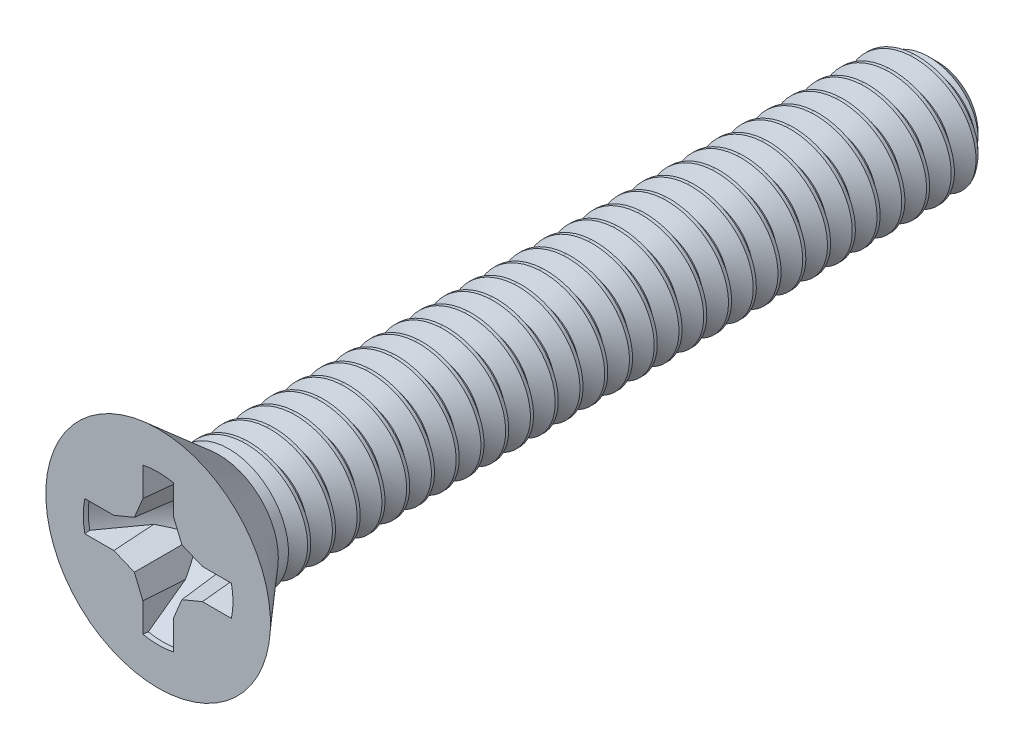
from build123d import *

# Parameters (mm, degrees)
CUT_EXTRUDE1_REACH = 16.581
CIRPATTERN1_COUNT  = 4
DRAFT2_ANGLE       = 5
CUT_SWEEP1_PITCH   = 0.453571429
CUT_SWEEP1_TO      = 12.9921


with BuildPart() as part:
    # Sketch3 → Revolve1 (revolve)
    with BuildSketch(Plane(origin=(0, 0, 0), x_dir=(0, 0, -1), z_dir=(1, 0, 0)), mode=Mode.PRIVATE) as revolve1_sk:
        Polygon((-1.2954, 0), (-1.2954, 2.0574), (-0.185064413, 1.0922), (-0.185064413, 0), align=None)
    revolve(revolve1_sk.sketch.rotate(Axis((0, 0, 1.2954), (0, 0, -1)), 180), axis=Axis((0, 0, 1.2954), (0, 0, -1)))

    # Sketch5 → Revolve2 (revolve)
    with BuildSketch(Plane(origin=(0, 0, 0), x_dir=(0, 0, -1), z_dir=(1, 0, 0))):
        Polygon((12.9921, 0), (-0.185064413, 0), (-0.185064413, 1.0922), (12.633778571, 1.0922), (12.9921, 0.733878571), align=None)
    revolve(axis=Axis((0, 0, -12.9921), (0, 0, 1)))

    # Cut-Extrude1: up to this cone (the profile starts inside it)
    cut_extrude1_end = Plane(origin=(0, 0, 1.2954), z_dir=(0, 0, 1)).offset(-1.66987845) * Cone(1e-06, 17.561750986, 20.202482509, align=(Align.CENTER, Align.CENTER, Align.MIN), mode=Mode.PRIVATE)
    # Sketch4 → Cut-Extrude1 (cut, up to the surface)
    with BuildSketch(Plane.XY.offset(1.2954), mode=Mode.PRIVATE) as cut_extrude1_sk1:
        with BuildLine():
            Line((0, 0), (1.3716, 0))
            ThreePointArc((1.3716, 0), (1.36439133, 0.140438096), (1.342841093, 0.2794))
            Line((1.342841093, 0.2794), (0.811120546, 0.2794))
            Line((0.811120546, 0.2794), (0.435137342, 0.435137342))
            Line((0.435137342, 0.435137342), (0.2794, 0.811120546))
            Line((0.2794, 0.811120546), (0.2794, 1.342841093))
            ThreePointArc((0.2794, 1.342841093), (0.140438096, 1.36439133), (0, 1.3716))
            Line((0, 1.3716), (0, 0))
        make_face()
    cut_extrude1_tool1 = extrude(cut_extrude1_sk1.sketch, amount=-CUT_EXTRUDE1_REACH, mode=Mode.PRIVATE) & cut_extrude1_end
    cut_extrude1 = cut_extrude1_tool1.solids().sort_by_distance((0.019397, 0.6858, 1.2954))[0]
    add(cut_extrude1, mode=Mode.SUBTRACT)

    # CirPattern1: Cut-Extrude1 ×4 about axis
    cirpattern1_axis = Axis((0, 0, 0), (0, 0, 1))
    for i in range(1, CIRPATTERN1_COUNT):
        add(cut_extrude1.rotate(cirpattern1_axis, i * 360 / CIRPATTERN1_COUNT), mode=Mode.SUBTRACT)

    # Draft2
    draft2_faces = [part.faces().sort_by_distance(p)[0] for p in [
        (-1.009640358, 0.2794, 1.06337498),
        (-0.612574228, 0.361640578, 0.873122436),
        (-0.361640578, 0.612574228, 0.873122436),
        (-0.2794, 1.009640358, 1.06337498),
        (0.2794, 1.009640358, 1.06337498),
        (0.361640578, 0.612574228, 0.873122436),
        (0.612574228, 0.361640578, 0.873122436),
        (1.009640358, 0.2794, 1.06337498),
        (1.009640358, -0.2794, 1.06337498),
        (0.612574228, -0.361640578, 0.873122436),
        (0.361640578, -0.612574228, 0.873122436),
        (0.2794, -1.009640358, 1.06337498),
        (-0.2794, -1.009640358, 1.06337498),
        (-0.361640578, -0.612574228, 0.873122436),
        (-0.612574228, -0.361640578, 0.873122436),
        (-1.009640358, -0.2794, 1.06337498),
    ]]
    draft(draft2_faces, Plane(origin=(0, 0, 1.2954), x_dir=(0, 1, 0), z_dir=(0, 0, 1)), DRAFT2_ANGLE)


with BuildPart() as body_2:
    # Split1: the piece on the far side of the plane
    add(part.part)
    split(bisect_by=Plane(origin=(0, 0, 0), x_dir=(0, -1, 0), z_dir=(0, 0, -1)), keep=Keep.BOTTOM)


with BuildPart() as part_1:
    add(part.part)

    # Split1
    split(bisect_by=Plane(origin=(0, 0, 0), x_dir=(0, -1, 0), z_dir=(0, 0, -1)), keep=Keep.TOP)

    # Cut-Sweep1: arcs per turn and ends read off the stored shape
    # Cut-Sweep1: the profile of Sketch7 screwed along a right-hand helix through 31.5 turns, 6 arcs to a turn; built about Z, then put on its axis
    cut_sweep1_z = Axis((0, 0, 0), (0, 0, 1))
    cut_sweep1_corners = [(0.797596715, 0, -0.226785714), (0.797596715, 0, -0.170089286), (1.116750274, 0, 0.014174107), (1.116750274, 0, -0.411049107)]
    with BuildLine(mode=Mode.PRIVATE) as cut_sweep1_profile:
        Line(cut_sweep1_corners[0], cut_sweep1_corners[1])
        Line(cut_sweep1_corners[1], cut_sweep1_corners[2])
        Line(cut_sweep1_corners[2], cut_sweep1_corners[3])
        Line(cut_sweep1_corners[3], cut_sweep1_corners[0])
    cut_sweep1_cap = Face(cut_sweep1_profile.wire())
    cut_sweep1_turn_angles = [0, 30, 60, 90, 120, 150, 180, 210, 240, 270, 300, 330, 360]
    cut_sweep1_turn_weights = [1, 0.8660254037844387, 1, 0.8660254037844387, 1, 0.8660254037844387, 1, 0.8660254037844387, 1, 0.8660254037844387, 1, 0.8660254037844387, 1]
    cut_sweep1_turn_rails = [Edge.make_bspline([Vector(p[0], p[1], 0).rotate(cut_sweep1_z, cut_sweep1_turn_angles[k]) / cut_sweep1_turn_weights[k] + Vector(0, 0, p[2] + CUT_SWEEP1_PITCH * cut_sweep1_turn_angles[k] / 360) for k in range(13)], [0, 0, 0, 1, 1, 2, 2, 3, 3, 4, 4, 5, 5, 6, 6, 6], 2, cut_sweep1_turn_weights) for p in cut_sweep1_corners]
    cut_sweep1_turn_sides = [Face.make_surface_from_curves(cut_sweep1_turn_rails[p[0]], cut_sweep1_turn_rails[p[1]]) for p in [(0, 1), (1, 2), (2, 3), (3, 0)]]
    cut_sweep1_last_angles = [11160, 11190, 11220, 11250, 11280, 11310, 11340]
    cut_sweep1_last_weights = [1, 0.8660254037844387, 1, 0.8660254037844387, 1, 0.8660254037841212, 1]
    cut_sweep1_last_rails = [Edge.make_bspline([Vector(p[0], p[1], 0).rotate(cut_sweep1_z, cut_sweep1_last_angles[k]) / cut_sweep1_last_weights[k] + Vector(0, 0, p[2] + CUT_SWEEP1_PITCH * cut_sweep1_last_angles[k] / 360) for k in range(7)], [0, 0, 0, 1, 1, 2, 2, 3, 3, 3], 2, cut_sweep1_last_weights) for p in cut_sweep1_corners]
    cut_sweep1_last_sides = [Face.make_surface_from_curves(cut_sweep1_last_rails[p[0]], cut_sweep1_last_rails[p[1]]) for p in [(0, 1), (1, 2), (2, 3), (3, 0)]]
    cut_sweep1 = Plane(origin=(0, 0, -12.9921), x_dir=(0, 1, 0), z_dir=(0, 0, 1)) * split(Solid(Shell([*[p.moved(Location((0, 0, CUT_SWEEP1_PITCH * i))) for i in range(31) for p in cut_sweep1_turn_sides], *cut_sweep1_last_sides, cut_sweep1_cap, cut_sweep1_cap.rotate(cut_sweep1_z, 11340).moved(Location((0, 0, CUT_SWEEP1_PITCH * 11340 / 360)))])), bisect_by=Plane.XY.offset(CUT_SWEEP1_TO), keep=Keep.BOTTOM, mode=Mode.PRIVATE)
    add(cut_sweep1, mode=Mode.SUBTRACT)


with BuildPart() as body_2_1:
    add(body_2.part)

    # Combine1: union part
    add(part_1.part)


solid = body_2_1.part
